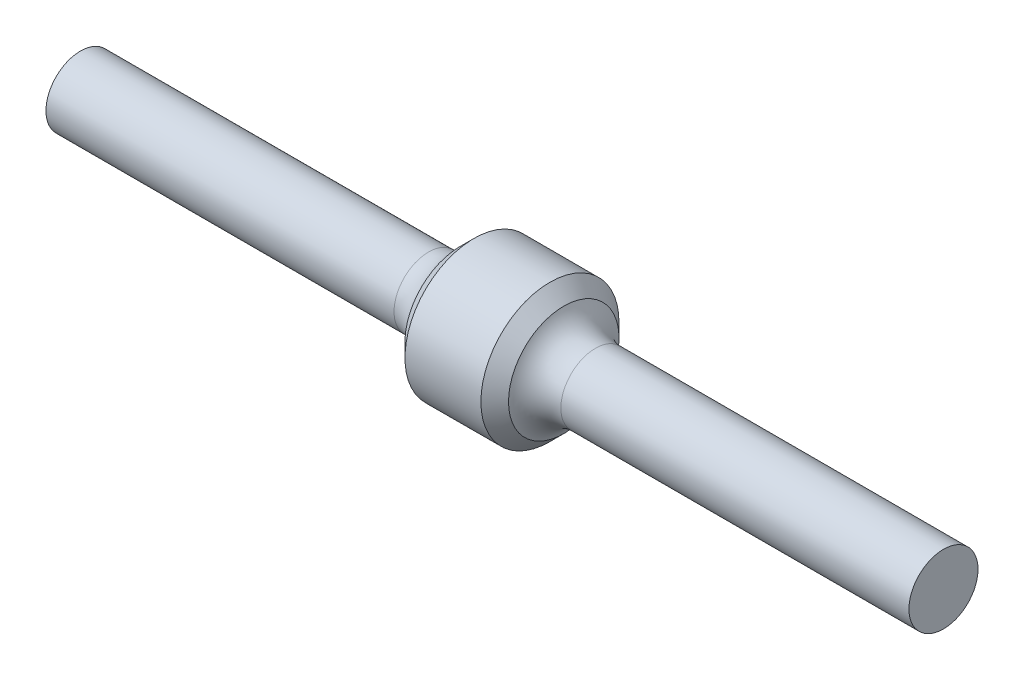
from build123d import *

# Parameters (mm, degrees)
SKETCH2_R           = 5
BOSS_EXTRUDE1_DEPTH = 62.5
SKETCH3_R           = 8
BOSS_EXTRUDE2_DEPTH = 7.5
FILLET1_R           = 5
SKETCH4_R           = 10
BOSS_EXTRUDE3_DEPTH = 7.5
CHAMFER1_SIZE       = 2


# Some blends are built 0.0001 mm under size
with BuildPart() as part:
    # Sketch2 → Boss-Extrude1 (new, symmetric)
    with BuildSketch(Plane(origin=(0, 0, 0), x_dir=(0, 0, -1), z_dir=(1, 0, 0))):
        Circle(SKETCH2_R)
    extrude(amount=BOSS_EXTRUDE1_DEPTH, both=True)

    # Sketch3 → Boss-Extrude2 (add, symmetric)
    with BuildSketch(Plane(origin=(0, 0, 0), x_dir=(0, 0, -1), z_dir=(1, 0, 0))):
        Circle(SKETCH3_R)
    extrude(amount=BOSS_EXTRUDE2_DEPTH, both=True)

    # Fillet1
    # the kernel refuses this fillet: 5 mm, written as the material it adds along each edge
    with BuildSketch(Plane(origin=(-7.5, 0, 0), x_dir=(0, 0, -1), z_dir=(0, -1, 0))) as fillet1_piece_1:
        with BuildLine():
            CenterArc((10, -4.582575695), FILLET1_R, 113.578178478, 66.421821522)
            Line((8, 0), (7.96, 0.091651514))
            ThreePointArc((7.96, 0.091651514), (6.5, 0.1), (5, 0.1))
            Line((5, 0.1), (4.9, 0))
            Line((4.9, 0), (4.9, -4.582575695))
            Line((4.9, -4.582575695), (5, -4.582575695))
        make_face()
    revolve(axis=Axis((-7.5, 0, 0), (1, 0, 0)))
    with BuildSketch(Plane(origin=(7.5, 0, 0), x_dir=(0, 0, -1), z_dir=(0, -1, 0))) as fillet1_piece_2:
        with BuildLine():
            CenterArc((10, 4.582575695), FILLET1_R, 180, 66.421821522)
            Line((5, 4.582575695), (4.9, 4.582575695))
            Line((4.9, 4.582575695), (4.9, 0))
            Line((4.9, 0), (5, -0.1))
            ThreePointArc((5, -0.1), (6.5, -0.1), (7.96, -0.091651514))
            Line((7.96, -0.091651514), (8, 0))
        make_face()
    revolve(axis=Axis((7.5, 0, 0), (1, 0, 0)))

    # Sketch4 → Boss-Extrude3 (add, symmetric)
    with BuildSketch(Plane(origin=(0, 0, 0), x_dir=(0, 0, -1), z_dir=(1, 0, 0))):
        Circle(SKETCH4_R)
    extrude(amount=BOSS_EXTRUDE3_DEPTH, both=True)

    # Chamfer1
    chamfer1_edges = [part.edges().sort_by_distance(p)[0] for p in [
        (-7.5, 0, 10),
        (7.5, 0, 10),
    ]]
    chamfer(chamfer1_edges, length=CHAMFER1_SIZE - 0.0001)  # a hair under: the kernel refuses the full size


solid = part.part
